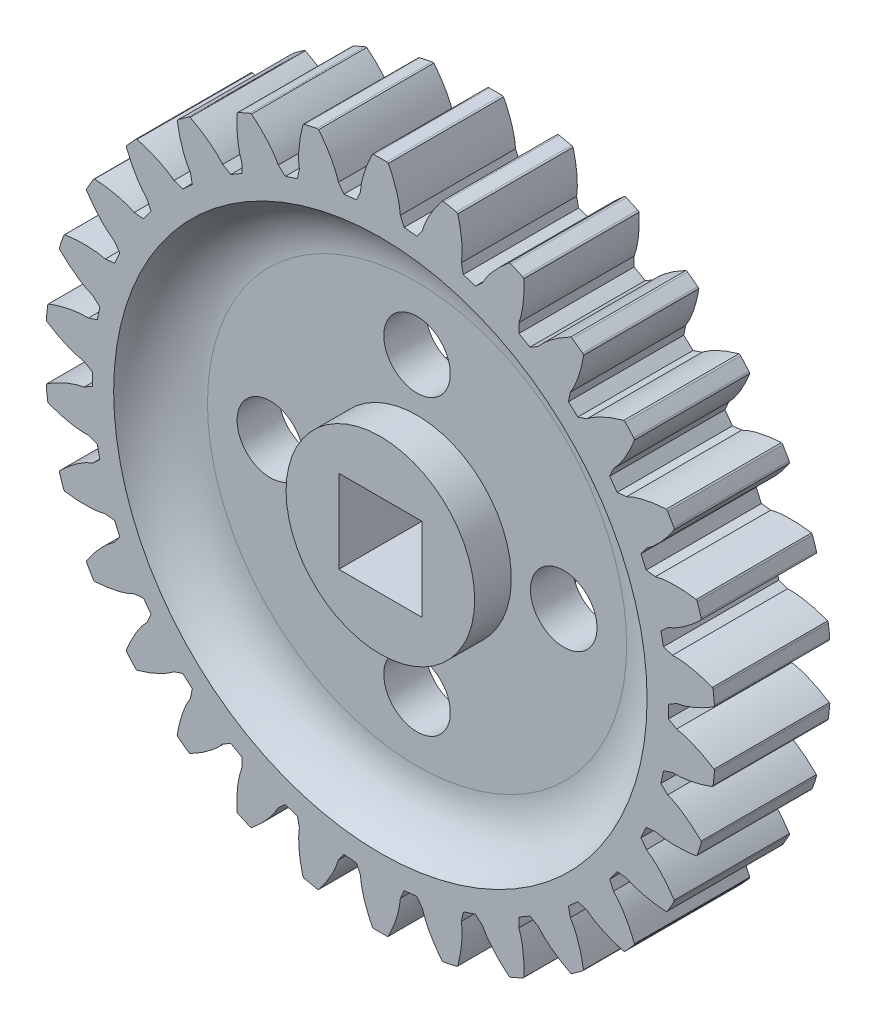
from build123d import *

# Parameters (mm, degrees)
BOSS_EXTRUDE1_DEPTH = 2.75
CIRPATTERN1_COUNT   = 4
SKETCH10_W          = 3.96875
SKETCH10_H          = 3.96875
CUT_EXTRUDE1_DEPTH  = 24.246147151


with BuildPart() as part:
    # Sketch1 → Boss-Extrude1 (new, symmetric)
    with BuildSketch(Plane.XY):
        with BuildLine():
            ThreePointArc((3.619571149, 15.585207881), (3.326587053, 15.650361612), (3.032432353, 15.710008085))
            add(Edge.make_bspline(
                [(2.94821418, 15.701878254), (2.98689529, 15.7187979), (3.032432353, 15.710008085)],
                knots=[0, 0, 0, 1, 1, 1], degree=2))
            add(Edge.make_bspline(
                [(2.002684585, 14.001333447), (2.021037482, 14.060934408), (2.039390379, 14.120535368), (2.14439226, 14.461528568), (2.613380053, 15.284185561), (2.94821418, 15.701878254)],
                knots=[-0.082147632, -0.082147632, -0.082147632, 0, 0, 0.469988803, 0.946949881, 0.946949881, 0.946949881], degree=2))
            add(Edge.make_bspline(
                [(1.737896443, 13.640815332), (1.799016307, 13.725511736), (1.860136171, 13.81020814), (1.905740786, 13.873404403), (1.953485414, 13.936409203), (1.978085, 13.968871325), (2.002684585, 14.001333447)],
                knots=[-1.340212241, -1.340212241, -1.340212241, 0, 0, 1, 1, 1.515232525, 1.515232525, 1.515232525], degree=2))
            add(Edge.make_bspline(
                [(1.136165743, 13.704059777), (1.221838194, 13.695875955), (1.307510644, 13.687692133), (1.437331013, 13.6752911), (1.566892815, 13.660429968), (1.652394629, 13.65062265), (1.737896443, 13.640815332)],
                knots=[-0.659930726, -0.659930726, -0.659930726, 0, 0, 1, 1, 1.659930726, 1.659930726, 1.659930726], degree=2))
            add(Edge.make_bspline(
                [(0.952119789, 14.111752257), (0.969432559, 14.074884968), (0.98674533, 14.03801768), (1.020347189, 13.966463019), (1.051815993, 13.895166015), (1.093990868, 13.799612896), (1.136165743, 13.704059777)],
                knots=[-0.515232525, -0.515232525, -0.515232525, 0, 0, 1, 1, 2.340212241, 2.340212241, 2.340212241], degree=2))
            add(Edge.make_bspline(
                [(0.380815431, 15.971722736), (0.721366486, 15.295101854), (0.922789827, 14.439409813), (0.940999578, 14.235980893), (0.946559683, 14.173866575), (0.952119789, 14.111752257)],
                knots=[0, 0, 0, 0.627512728, 0.879079195, 0.879079195, 0.955891673, 0.955891673, 0.955891673], degree=2))
            add(Edge.make_bspline(
                [(0.300127913, 15.997184853), (0.346497388, 15.996314902), (0.380815431, 15.971722736)],
                knots=[0, 0, 0, 1, 1, 1], degree=2))
            ThreePointArc((0.300127913, 15.997184853), (0, 16), (-0.300127913, 15.997184853))
            add(Edge.make_bspline(
                [(-0.380815431, 15.971722736), (-0.346497388, 15.996314902), (-0.300127913, 15.997184853)],
                knots=[0, 0, 0, 1, 1, 1], degree=2))
            add(Edge.make_bspline(
                [(-0.952119789, 14.111752257), (-0.946559683, 14.173866575), (-0.940999578, 14.235980893), (-0.909188712, 14.591353692), (-0.621489434, 15.493541701), (-0.380815431, 15.971722736)],
                knots=[-0.082147632, -0.082147632, -0.082147632, 0, 0, 0.469988803, 0.946949881, 0.946949881, 0.946949881], degree=2))
            add(Edge.make_bspline(
                [(-1.136165743, 13.704059777), (-1.093990868, 13.799612896), (-1.051815993, 13.895166015), (-1.020347189, 13.966463019), (-0.98674533, 14.03801768), (-0.969432559, 14.074884968), (-0.952119789, 14.111752257)],
                knots=[-1.340212241, -1.340212241, -1.340212241, 0, 0, 1, 1, 1.515232525, 1.515232525, 1.515232525], degree=2))
            add(Edge.make_bspline(
                [(-1.737896443, 13.640815332), (-1.652394629, 13.65062265), (-1.566892815, 13.660429968), (-1.437331013, 13.6752911), (-1.307510644, 13.687692133), (-1.221838194, 13.695875955), (-1.136165743, 13.704059777)],
                knots=[-0.659930726, -0.659930726, -0.659930726, 0, 0, 1, 1, 1.659930726, 1.659930726, 1.659930726], degree=2))
            add(Edge.make_bspline(
                [(-2.002684585, 14.001333447), (-1.978085, 13.968871325), (-1.953485414, 13.936409203), (-1.905740786, 13.873404403), (-1.860136171, 13.81020814), (-1.799016307, 13.725511736), (-1.737896443, 13.640815332)],
                knots=[-0.515232525, -0.515232525, -0.515232525, 0, 0, 1, 1, 2.340212241, 2.340212241, 2.340212241], degree=2))
            add(Edge.make_bspline(
                [(-2.94821418, 15.701878254), (-2.47442759, 15.110847707), (-2.099497453, 14.315732858), (-2.039390379, 14.120535368), (-2.021037482, 14.060934408), (-2.002684585, 14.001333447)],
                knots=[0, 0, 0, 0.627512728, 0.879079195, 0.879079195, 0.955891673, 0.955891673, 0.955891673], degree=2))
            add(Edge.make_bspline(
                [(-3.032432353, 15.710008085), (-2.98689529, 15.7187979), (-2.94821418, 15.701878254)],
                knots=[0, 0, 0, 1, 1, 1], degree=2))
            ThreePointArc((-3.032432353, 15.710008085), (-3.326587053, 15.650361612), (-3.619571149, 15.585207881))
            add(Edge.make_bspline(
                [(-3.693201579, 15.543526294), (-3.664746466, 15.574716184), (-3.619571149, 15.585207881)],
                knots=[0, 0, 0, 1, 1, 1], degree=2))
            add(Edge.make_bspline(
                [(-3.865311959, 13.605419777), (-3.872787648, 13.667332759), (-3.880263337, 13.729245741), (-3.923033774, 14.083466643), (-3.82919685, 15.025755723), (-3.693201579, 15.543526294)],
                knots=[-0.082147632, -0.082147632, -0.082147632, 0, 0, 0.469988803, 0.946949881, 0.946949881, 0.946949881], degree=2))
            add(Edge.make_bspline(
                [(-3.960572035, 13.168371051), (-3.939185393, 13.270604754), (-3.91779875, 13.372838458), (-3.901841096, 13.449120184), (-3.883850569, 13.526097423), (-3.874581264, 13.5657586), (-3.865311959, 13.605419777)],
                knots=[-1.340212241, -1.340212241, -1.340212241, 0, 0, 1, 1, 1.515232525, 1.515232525, 1.515232525], degree=2))
            add(Edge.make_bspline(
                [(-4.536004216, 12.981401801), (-4.454409878, 13.008771632), (-4.37281554, 13.036141463), (-4.249174777, 13.077615258), (-4.124769614, 13.11673647), (-4.042670825, 13.14255376), (-3.960572035, 13.168371051)],
                knots=[-0.659930726, -0.659930726, -0.659930726, 0, 0, 1, 1, 1.659930726, 1.659930726, 1.659930726], degree=2))
            add(Edge.make_bspline(
                [(-4.869962033, 13.27898918), (-4.839150753, 13.252350975), (-4.808339472, 13.225712769), (-4.748538744, 13.174011441), (-4.690791458, 13.121677902), (-4.613397837, 13.051539851), (-4.536004216, 12.981401801)],
                knots=[-0.515232525, -0.515232525, -0.515232525, 0, 0, 1, 1, 2.340212241, 2.340212241, 2.340212241], degree=2))
            add(Edge.make_bspline(
                [(-6.148392683, 14.745786346), (-5.562077307, 14.266177006), (-5.030026621, 13.566389682), (-4.930649189, 13.387954689), (-4.900305611, 13.333471935), (-4.869962033, 13.27898918)],
                knots=[0, 0, 0, 0.627512728, 0.879079195, 0.879079195, 0.955891673, 0.955891673, 0.955891673], degree=2))
            add(Edge.make_bspline(
                [(-6.232460774, 14.736228578), (-6.18974631, 14.754294002), (-6.148392683, 14.745786346)],
                knots=[0, 0, 0, 1, 1, 1], degree=2))
            ThreePointArc((-6.232460774, 14.736228578), (-6.507786289, 14.616727322), (-6.780821758, 14.492082538))
            add(Edge.make_bspline(
                [(-6.844177097, 14.436003166), (-6.822828539, 14.472427634), (-6.780821758, 14.492082538)],
                knots=[0, 0, 0, 1, 1, 1], degree=2))
            add(Edge.make_bspline(
                [(-6.609571449, 12.504465167), (-6.629756209, 12.563470919), (-6.649940969, 12.62247667), (-6.765423436, 12.960064522), (-6.86954999, 13.901272118), (-6.844177097, 14.436003166)],
                knots=[-0.082147632, -0.082147632, -0.082147632, 0, 0, 0.469988803, 0.946949881, 0.946949881, 0.946949881], degree=2))
            add(Edge.make_bspline(
                [(-6.611882324, 12.05716132), (-6.612218613, 12.161607505), (-6.612554902, 12.26605369), (-6.612805824, 12.34398626), (-6.611212901, 12.423021803), (-6.610392175, 12.463743485), (-6.609571449, 12.504465167)],
                knots=[-1.340212241, -1.340212241, -1.340212241, 0, 0, 1, 1, 1.515232525, 1.515232525, 1.515232525], degree=2))
            add(Edge.make_bspline(
                [(-7.135866839, 11.75463872), (-7.06174604, 11.798374871), (-6.987625242, 11.842111023), (-6.875309213, 11.908384875), (-6.761756359, 11.972516483), (-6.686819342, 12.014838902), (-6.611882324, 12.05716132)],
                knots=[-0.659930726, -0.659930726, -0.659930726, 0, 0, 1, 1, 1.659930726, 1.659930726, 1.659930726], degree=2))
            add(Edge.make_bspline(
                [(-7.524398771, 11.976289366), (-7.488722397, 11.956639295), (-7.453046023, 11.936989223), (-7.383802773, 11.898850964), (-7.316436649, 11.859667374), (-7.226151744, 11.807153047), (-7.135866839, 11.75463872)],
                knots=[-0.515232525, -0.515232525, -0.515232525, 0, 0, 1, 1, 2.340212241, 2.340212241, 2.340212241], degree=2))
            add(Edge.make_bspline(
                [(-9.079856923, 13.145232817), (-8.406637555, 12.798005913), (-7.740719488, 12.224130179), (-7.606414971, 12.070256148), (-7.565406871, 12.023272757), (-7.524398771, 11.976289366)],
                knots=[0, 0, 0, 0.627512728, 0.879079195, 0.879079195, 0.955891673, 0.955891673, 0.955891673], degree=2))
            add(Edge.make_bspline(
                [(-9.160100753, 13.11840517), (-9.122075715, 13.144956657), (-9.079856923, 13.145232817)],
                knots=[0, 0, 0, 1, 1, 1], degree=2))
            ThreePointArc((-9.160100753, 13.11840517), (-9.404564037, 12.94427191), (-9.645717917, 12.765583647))
            add(Edge.make_bspline(
                [(-9.696029233, 12.697557429), (-9.682720265, 12.737624549), (-9.645717917, 12.765583647)],
                knots=[0, 0, 0, 1, 1, 1], degree=2))
            add(Edge.make_bspline(
                [(-9.06496095, 10.857005426), (-9.096972611, 10.910525113), (-9.128984271, 10.9640448), (-9.31213163, 11.270245392), (-9.609670831, 12.169236216), (-9.696029233, 12.697557429)],
                knots=[-0.082147632, -0.082147632, -0.082147632, 0, 0, 0.469988803, 0.946949881, 0.946949881, 0.946949881], degree=2))
            add(Edge.make_bspline(
                [(-8.974221628, 10.418995784), (-8.996266151, 10.52108965), (-9.018310674, 10.623183517), (-9.034759206, 10.699360904), (-9.049633505, 10.777000518), (-9.057297228, 10.817002972), (-9.06496095, 10.857005426)],
                knots=[-1.340212241, -1.340212241, -1.340212241, 0, 0, 1, 1, 1.515232525, 1.515232525, 1.515232525], degree=2))
            add(Edge.make_bspline(
                [(-9.423857839, 10.014141521), (-9.360450015, 10.072332514), (-9.297042191, 10.130523506), (-9.200959646, 10.218700931), (-9.103221905, 10.305040075), (-9.038721767, 10.362017929), (-8.974221628, 10.418995784)],
                knots=[-0.659930726, -0.659930726, -0.659930726, 0, 0, 1, 1, 1.659930726, 1.659930726, 1.659930726], degree=2))
            add(Edge.make_bspline(
                [(-9.849983177, 10.150168239), (-9.811000937, 10.138365103), (-9.772018698, 10.126561968), (-9.69635919, 10.103653603), (-9.62231845, 10.079332473), (-9.523088144, 10.046736997), (-9.423857839, 10.014141521)],
                knots=[-0.515232525, -0.515232525, -0.515232525, 0, 0, 1, 1, 2.340212241, 2.340212241, 2.340212241], degree=2))
            add(Edge.make_bspline(
                [(-11.614487845, 10.970169536), (-10.883787403, 10.770500549), (-10.113105769, 10.347617528), (-9.949743918, 10.225029494), (-9.899863547, 10.187598866), (-9.849983177, 10.150168239)],
                knots=[0, 0, 0, 0.627512728, 0.879079195, 0.879079195, 0.955891673, 0.955891673, 0.955891673], degree=2))
            add(Edge.make_bspline(
                [(-11.687400373, 10.927244507), (-11.655726639, 10.961121631), (-11.614487845, 10.970169536)],
                knots=[0, 0, 0, 1, 1, 1], degree=2))
            ThreePointArc((-11.687400373, 10.927244507), (-11.890317208, 10.706089702), (-12.089049919, 10.481167495))
            add(Edge.make_bspline(
                [(-12.124118365, 10.404167502), (-12.119430653, 10.446126149), (-12.089049919, 10.481167495)],
                knots=[0, 0, 0, 1, 1, 1], degree=2))
            add(Edge.make_bspline(
                [(-11.12416816, 8.73504245), (-11.166607657, 8.780737005), (-11.209047154, 8.82643156), (-11.451854987, 9.087862457), (-11.929802945, 9.905346296), (-12.124118365, 10.404167502)],
                knots=[-0.082147632, -0.082147632, -0.082147632, 0, 0, 0.469988803, 0.946949881, 0.946949881, 0.946949881], degree=2))
            add(Edge.make_bspline(
                [(-10.944344384, 8.325470135), (-10.98713369, 8.420749692), (-11.029922996, 8.516029249), (-11.061850257, 8.587122135), (-11.0925417, 8.659972596), (-11.10835493, 8.697507523), (-11.12416816, 8.73504245)],
                knots=[-1.340212241, -1.340212241, -1.340212241, 0, 0, 1, 1, 1.515232525, 1.515232525, 1.515232525], degree=2))
            add(Edge.make_bspline(
                [(-11.29998103, 7.835978285), (-11.250057407, 7.906080893), (-11.200133784, 7.9761835), (-11.12448399, 8.082410721), (-11.046832971, 8.187183967), (-10.995588678, 8.256327051), (-10.944344384, 8.325470135)],
                knots=[-0.659930726, -0.659930726, -0.659930726, 0, 0, 1, 1, 1.659930726, 1.659930726, 1.659930726], degree=2))
            add(Edge.make_bspline(
                [(-11.745076052, 7.880436053), (-11.704491658, 7.876995708), (-11.663907265, 7.873555363), (-11.585138181, 7.866878096), (-11.507658762, 7.858482377), (-11.403819896, 7.847230331), (-11.29998103, 7.835978285)],
                knots=[-0.515232525, -0.515232525, -0.515232525, 0, 0, 1, 1, 2.340212241, 2.340212241, 2.340212241], degree=2))
            add(Edge.make_bspline(
                [(-13.641509916, 8.315657205), (-12.885263516, 8.27227263), (-12.0435008, 8.018864339), (-11.858221312, 7.932919986), (-11.801648682, 7.906678019), (-11.745076052, 7.880436053)],
                knots=[0, 0, 0, 0.627512728, 0.879079195, 0.879079195, 0.955891673, 0.955891673, 0.955891673], degree=2))
            add(Edge.make_bspline(
                [(-13.703904515, 8.258510824), (-13.679966378, 8.298232991), (-13.641509916, 8.315657205)],
                knots=[0, 0, 0, 1, 1, 1], degree=2))
            ThreePointArc((-13.703904515, 8.258510824), (-13.856406461, 8), (-14.004032429, 7.738674029))
            add(Edge.make_bspline(
                [(-14.022325347, 7.656065531), (-14.026463766, 7.698081911), (-14.004032429, 7.738674029)],
                knots=[0, 0, 0, 1, 1, 1], degree=2))
            add(Edge.make_bspline(
                [(-12.697195841, 6.231316204), (-12.748208365, 6.267188556), (-12.79922089, 6.303060907), (-13.091077329, 6.508296325), (-13.728545425, 7.208545213), (-14.022325347, 7.656065531)],
                knots=[-0.082147632, -0.082147632, -0.082147632, 0, 0, 0.469988803, 0.946949881, 0.946949881, 0.946949881], degree=2))
            add(Edge.make_bspline(
                [(-12.436146774, 5.868081492), (-12.497810764, 5.952382565), (-12.559474755, 6.036683638), (-12.60548537, 6.099584923), (-12.650652595, 6.164462317), (-12.673924218, 6.197889261), (-12.697195841, 6.231316204)],
                knots=[-1.340212241, -1.340212241, -1.340212241, 0, 0, 1, 1, 1.515232525, 1.515232525, 1.515232525], degree=2))
            add(Edge.make_bspline(
                [(-12.682240828, 5.315345197), (-12.647983307, 5.394295599), (-12.613725786, 5.473246001), (-12.561815003, 5.592880379), (-12.507644428, 5.711508633), (-12.471895601, 5.789795062), (-12.436146774, 5.868081492)],
                knots=[-0.659930726, -0.659930726, -0.659930726, 0, 0, 1, 1, 1.659930726, 1.659930726, 1.659930726], degree=2))
            add(Edge.make_bspline(
                [(-13.126852745, 5.266290997), (-13.08643993, 5.271363802), (-13.046027114, 5.276436607), (-12.967591043, 5.286282268), (-12.890059167, 5.294178892), (-12.786149997, 5.304762044), (-12.682240828, 5.315345197)],
                knots=[-0.515232525, -0.515232525, -0.515232525, 0, 0, 1, 1, 2.340212241, 2.340212241, 2.340212241], degree=2))
            add(Edge.make_bspline(
                [(-15.072332545, 5.297710752), (-14.323591782, 5.412506701), (-13.447537055, 5.339648299), (-13.248437533, 5.294103808), (-13.187645139, 5.280197402), (-13.126852745, 5.266290997)],
                knots=[0, 0, 0, 0.627512728, 0.879079195, 0.879079195, 0.955891673, 0.955891673, 0.955891673], degree=2))
            add(Edge.make_bspline(
                [(-15.121482272, 5.22884059), (-15.106325943, 5.27267175), (-15.072332545, 5.297710752)],
                knots=[0, 0, 0, 1, 1, 1], degree=2))
            ThreePointArc((-15.121482272, 5.22884059), (-15.216904261, 4.94427191), (-15.306971523, 4.657963374))
            add(Edge.make_bspline(
                [(-15.307689424, 4.573356758), (-15.320473106, 4.613594554), (-15.306971523, 4.657963374)],
                knots=[0, 0, 0, 1, 1, 1], degree=2))
            add(Edge.make_bspline(
                [(-13.715295136, 3.455251538), (-13.772651195, 3.479733893), (-13.830007255, 3.504216247), (-14.158156773, 3.644286413), (-14.927284592, 4.196696113), (-15.307689424, 4.573356758)],
                knots=[-0.082147632, -0.082147632, -0.082147632, 0, 0, 0.469988803, 0.946949881, 0.946949881, 0.946949881], degree=2))
            add(Edge.make_bspline(
                [(-13.384429874, 3.154229529), (-13.462273537, 3.223867757), (-13.5401172, 3.293505985), (-13.598200286, 3.345466581), (-13.655869267, 3.399535454), (-13.685582201, 3.427393496), (-13.715295136, 3.455251538)],
                knots=[-1.340212241, -1.340212241, -1.340212241, 0, 0, 1, 1, 1.515232525, 1.515232525, 1.515232525], degree=2))
            add(Edge.make_bspline(
                [(-13.510225845, 2.562406018), (-13.493131645, 2.646753703), (-13.476037445, 2.731101388), (-13.450134423, 2.858914327), (-13.421811805, 2.986212965), (-13.40312084, 3.070221247), (-13.384429874, 3.154229529)],
                knots=[-0.659930726, -0.659930726, -0.659930726, 0, 0, 1, 1, 1.659930726, 1.659930726, 1.659930726], degree=2))
            add(Edge.make_bspline(
                [(-13.934922983, 2.421983754), (-13.89644798, 2.435348003), (-13.857972977, 2.448712251), (-13.78329795, 2.474650537), (-13.709102132, 2.498494385), (-13.609663988, 2.530450201), (-13.510225845, 2.562406018)],
                knots=[-0.515232525, -0.515232525, -0.515232525, 0, 0, 1, 1, 2.340212241, 2.340212241, 2.340212241], degree=2))
            add(Edge.make_bspline(
                [(-15.844421916, 2.048228917), (-15.135910355, 2.316188258), (-14.263851413, 2.427064006), (-14.05963346, 2.423909889), (-13.997278222, 2.422946822), (-13.934922983, 2.421983754)],
                knots=[0, 0, 0, 0.627512728, 0.879079195, 0.879079195, 0.955891673, 0.955891673, 0.955891673], degree=2))
            add(Edge.make_bspline(
                [(-15.878178691, 1.97064493), (-15.872466576, 2.016669453), (-15.844421916, 2.048228917)],
                knots=[0, 0, 0, 1, 1, 1], degree=2))
            ThreePointArc((-15.878178691, 1.97064493), (-15.912350326, 1.672455412), (-15.940922511, 1.373677368))
            add(Edge.make_bspline(
                [(-15.924034019, 1.29077035), (-15.944904255, 1.327470976), (-15.940922511, 1.373677368)],
                knots=[0, 0, 0, 1, 1, 1], degree=2))
            add(Edge.make_bspline(
                [(-14.13397022, 0.528175801), (-14.19516308, 0.540198161), (-14.25635594, 0.552220522), (-14.606456829, 0.621003698), (-15.473629794, 1.001431255), (-15.924034019, 1.29077035)],
                knots=[-0.082147632, -0.082147632, -0.082147632, 0, 0, 0.469988803, 0.946949881, 0.946949881, 0.946949881], degree=2))
            add(Edge.make_bspline(
                [(-13.747749163, 0.302522601), (-13.838370357, 0.354454458), (-13.928991551, 0.406386316), (-13.996608597, 0.445135296), (-14.064258923, 0.486032579), (-14.099114572, 0.50710419), (-14.13397022, 0.528175801)],
                knots=[-1.340212241, -1.340212241, -1.340212241, 0, 0, 1, 1, 1.515232525, 1.515232525, 1.515232525], degree=2))
            add(Edge.make_bspline(
                [(-13.747749163, -0.302522601), (-13.748565382, -0.21646403), (-13.749381601, -0.13040546), (-13.750618427, 0), (-13.749381601, 0.13040546), (-13.748565382, 0.21646403), (-13.747749163, 0.302522601)],
                knots=[-0.659930726, -0.659930726, -0.659930726, 0, 0, 1, 1, 1.659930726, 1.659930726, 1.659930726], degree=2))
            add(Edge.make_bspline(
                [(-14.13397022, -0.528175801), (-14.099114572, -0.50710419), (-14.064258923, -0.486032579), (-13.996608597, -0.445135296), (-13.928991551, -0.406386316), (-13.838370357, -0.354454458), (-13.747749163, -0.302522601)],
                knots=[-0.515232525, -0.515232525, -0.515232525, 0, 0, 1, 1, 2.340212241, 2.340212241, 2.340212241], degree=2))
            add(Edge.make_bspline(
                [(-15.924034019, -1.29077035), (-15.286717016, -0.881358727), (-14.456767018, -0.591594631), (-14.25635594, -0.552220522), (-14.19516308, -0.540198161), (-14.13397022, -0.528175801)],
                knots=[0, 0, 0, 0.627512728, 0.879079195, 0.879079195, 0.955891673, 0.955891673, 0.955891673], degree=2))
            add(Edge.make_bspline(
                [(-15.940922511, -1.373677368), (-15.944904255, -1.327470976), (-15.924034019, -1.29077035)],
                knots=[0, 0, 0, 1, 1, 1], degree=2))
            ThreePointArc((-15.940922511, -1.373677368), (-15.912350326, -1.672455412), (-15.878178691, -1.97064493))
            add(Edge.make_bspline(
                [(-15.844421916, -2.048228917), (-15.872466576, -2.016669453), (-15.878178691, -1.97064493)],
                knots=[0, 0, 0, 1, 1, 1], degree=2))
            add(Edge.make_bspline(
                [(-13.934922983, -2.421983754), (-13.997278222, -2.422946822), (-14.05963346, -2.423909889), (-14.416384631, -2.429419859), (-15.343703123, -2.237600954), (-15.844421916, -2.048228917)],
                knots=[-0.082147632, -0.082147632, -0.082147632, 0, 0, 0.469988803, 0.946949881, 0.946949881, 0.946949881], degree=2))
            add(Edge.make_bspline(
                [(-13.510225845, -2.562406018), (-13.609663988, -2.530450201), (-13.709102132, -2.498494385), (-13.78329795, -2.474650537), (-13.857972977, -2.448712251), (-13.89644798, -2.435348003), (-13.934922983, -2.421983754)],
                knots=[-1.340212241, -1.340212241, -1.340212241, 0, 0, 1, 1, 1.515232525, 1.515232525, 1.515232525], degree=2))
            add(Edge.make_bspline(
                [(-13.384429874, -3.154229529), (-13.40312084, -3.070221247), (-13.421811805, -2.986212965), (-13.450134423, -2.858914327), (-13.476037445, -2.731101388), (-13.493131645, -2.646753703), (-13.510225845, -2.562406018)],
                knots=[-0.659930726, -0.659930726, -0.659930726, 0, 0, 1, 1, 1.659930726, 1.659930726, 1.659930726], degree=2))
            add(Edge.make_bspline(
                [(-13.715295136, -3.455251538), (-13.685582201, -3.427393496), (-13.655869267, -3.399535454), (-13.598200286, -3.345466581), (-13.5401172, -3.293505985), (-13.462273537, -3.223867757), (-13.384429874, -3.154229529)],
                knots=[-0.515232525, -0.515232525, -0.515232525, 0, 0, 1, 1, 2.340212241, 2.340212241, 2.340212241], degree=2))
            add(Edge.make_bspline(
                [(-15.307689424, -4.573356758), (-14.769420789, -4.040386106), (-14.017852533, -3.584397743), (-13.830007255, -3.504216247), (-13.772651195, -3.479733893), (-13.715295136, -3.455251538)],
                knots=[0, 0, 0, 0.627512728, 0.879079195, 0.879079195, 0.955891673, 0.955891673, 0.955891673], degree=2))
            add(Edge.make_bspline(
                [(-15.306971523, -4.657963374), (-15.320473106, -4.613594554), (-15.307689424, -4.573356758)],
                knots=[0, 0, 0, 1, 1, 1], degree=2))
            ThreePointArc((-15.306971523, -4.657963374), (-15.216904261, -4.94427191), (-15.121482272, -5.22884059))
            add(Edge.make_bspline(
                [(-15.072332545, -5.297710752), (-15.106325943, -5.27267175), (-15.121482272, -5.22884059)],
                knots=[0, 0, 0, 1, 1, 1], degree=2))
            add(Edge.make_bspline(
                [(-13.126852745, -5.266290997), (-13.187645139, -5.280197402), (-13.248437533, -5.294103808), (-13.596247247, -5.373666111), (-14.543182998, -5.378839264), (-15.072332545, -5.297710752)],
                knots=[-0.082147632, -0.082147632, -0.082147632, 0, 0, 0.469988803, 0.946949881, 0.946949881, 0.946949881], degree=2))
            add(Edge.make_bspline(
                [(-12.682240828, -5.315345197), (-12.786149997, -5.304762044), (-12.890059167, -5.294178892), (-12.967591043, -5.286282268), (-13.046027114, -5.276436607), (-13.08643993, -5.271363802), (-13.126852745, -5.266290997)],
                knots=[-1.340212241, -1.340212241, -1.340212241, 0, 0, 1, 1, 1.515232525, 1.515232525, 1.515232525], degree=2))
            add(Edge.make_bspline(
                [(-12.436146774, -5.868081492), (-12.471895601, -5.789795062), (-12.507644428, -5.711508633), (-12.561815003, -5.592880379), (-12.613725786, -5.473246001), (-12.647983307, -5.394295599), (-12.682240828, -5.315345197)],
                knots=[-0.659930726, -0.659930726, -0.659930726, 0, 0, 1, 1, 1.659930726, 1.659930726, 1.659930726], degree=2))
            add(Edge.make_bspline(
                [(-12.697195841, -6.231316204), (-12.673924218, -6.197889261), (-12.650652595, -6.164462317), (-12.60548537, -6.099584923), (-12.559474755, -6.036683638), (-12.497810764, -5.952382565), (-12.436146774, -5.868081492)],
                knots=[-0.515232525, -0.515232525, -0.515232525, 0, 0, 1, 1, 2.340212241, 2.340212241, 2.340212241], degree=2))
            add(Edge.make_bspline(
                [(-14.022325347, -7.656065531), (-13.606630002, -7.022829224), (-12.966290627, -6.420545474), (-12.79922089, -6.303060907), (-12.748208365, -6.267188556), (-12.697195841, -6.231316204)],
                knots=[0, 0, 0, 0.627512728, 0.879079195, 0.879079195, 0.955891673, 0.955891673, 0.955891673], degree=2))
            add(Edge.make_bspline(
                [(-14.004032429, -7.738674029), (-14.026463766, -7.698081911), (-14.022325347, -7.656065531)],
                knots=[0, 0, 0, 1, 1, 1], degree=2))
            ThreePointArc((-14.004032429, -7.738674029), (-13.856406461, -8), (-13.703904515, -8.258510824))
            add(Edge.make_bspline(
                [(-13.641509916, -8.315657205), (-13.679966378, -8.298232991), (-13.703904515, -8.258510824)],
                knots=[0, 0, 0, 1, 1, 1], degree=2))
            add(Edge.make_bspline(
                [(-11.745076052, -7.880436053), (-11.801648682, -7.906678019), (-11.858221312, -7.932919986), (-12.181888617, -8.083057367), (-13.107055991, -8.284996488), (-13.641509916, -8.315657205)],
                knots=[-0.082147632, -0.082147632, -0.082147632, 0, 0, 0.469988803, 0.946949881, 0.946949881, 0.946949881], degree=2))
            add(Edge.make_bspline(
                [(-11.29998103, -7.835978285), (-11.403819896, -7.847230331), (-11.507658762, -7.858482377), (-11.585138181, -7.866878096), (-11.663907265, -7.873555363), (-11.704491658, -7.876995708), (-11.745076052, -7.880436053)],
                knots=[-1.340212241, -1.340212241, -1.340212241, 0, 0, 1, 1, 1.515232525, 1.515232525, 1.515232525], degree=2))
            add(Edge.make_bspline(
                [(-10.944344384, -8.325470135), (-10.995588678, -8.256327051), (-11.046832971, -8.187183967), (-11.12448399, -8.082410721), (-11.200133784, -7.9761835), (-11.250057407, -7.906080893), (-11.29998103, -7.835978285)],
                knots=[-0.659930726, -0.659930726, -0.659930726, 0, 0, 1, 1, 1.659930726, 1.659930726, 1.659930726], degree=2))
            add(Edge.make_bspline(
                [(-11.12416816, -8.73504245), (-11.10835493, -8.697507523), (-11.0925417, -8.659972596), (-11.061850257, -8.587122135), (-11.029922996, -8.516029249), (-10.98713369, -8.420749692), (-10.944344384, -8.325470135)],
                knots=[-0.515232525, -0.515232525, -0.515232525, 0, 0, 1, 1, 2.340212241, 2.340212241, 2.340212241], degree=2))
            add(Edge.make_bspline(
                [(-12.124118365, -10.404167502), (-11.849164192, -9.698341006), (-11.348039602, -8.976084559), (-11.209047154, -8.82643156), (-11.166607657, -8.780737005), (-11.12416816, -8.73504245)],
                knots=[0, 0, 0, 0.627512728, 0.879079195, 0.879079195, 0.955891673, 0.955891673, 0.955891673], degree=2))
            add(Edge.make_bspline(
                [(-12.089049919, -10.481167495), (-12.119430653, -10.446126149), (-12.124118365, -10.404167502)],
                knots=[0, 0, 0, 1, 1, 1], degree=2))
            ThreePointArc((-12.089049919, -10.481167495), (-11.890317208, -10.706089702), (-11.687400373, -10.927244507))
            add(Edge.make_bspline(
                [(-11.614487845, -10.970169536), (-11.655726639, -10.961121631), (-11.687400373, -10.927244507)],
                knots=[0, 0, 0, 1, 1, 1], degree=2))
            add(Edge.make_bspline(
                [(-9.849983177, -10.150168239), (-9.899863547, -10.187598866), (-9.949743918, -10.225029494), (-10.235122999, -10.43918023), (-11.098087742, -10.82905961), (-11.614487845, -10.970169536)],
                knots=[-0.082147632, -0.082147632, -0.082147632, 0, 0, 0.469988803, 0.946949881, 0.946949881, 0.946949881], degree=2))
            add(Edge.make_bspline(
                [(-9.423857839, -10.014141521), (-9.523088144, -10.046736997), (-9.62231845, -10.079332473), (-9.69635919, -10.103653603), (-9.772018698, -10.126561968), (-9.811000937, -10.138365103), (-9.849983177, -10.150168239)],
                knots=[-1.340212241, -1.340212241, -1.340212241, 0, 0, 1, 1, 1.515232525, 1.515232525, 1.515232525], degree=2))
            add(Edge.make_bspline(
                [(-8.974221628, -10.418995784), (-9.038721767, -10.362017929), (-9.103221905, -10.305040075), (-9.200959646, -10.218700931), (-9.297042191, -10.130523506), (-9.360450015, -10.072332514), (-9.423857839, -10.014141521)],
                knots=[-0.659930726, -0.659930726, -0.659930726, 0, 0, 1, 1, 1.659930726, 1.659930726, 1.659930726], degree=2))
            add(Edge.make_bspline(
                [(-9.06496095, -10.857005426), (-9.057297228, -10.817002972), (-9.049633505, -10.777000518), (-9.034759206, -10.699360904), (-9.018310674, -10.623183517), (-8.996266151, -10.52108965), (-8.974221628, -10.418995784)],
                knots=[-0.515232525, -0.515232525, -0.515232525, 0, 0, 1, 1, 2.340212241, 2.340212241, 2.340212241], degree=2))
            add(Edge.make_bspline(
                [(-9.696029233, -12.697557429), (-9.573833049, -11.949988748), (-9.233824792, -11.139325676), (-9.128984271, -10.9640448), (-9.096972611, -10.910525113), (-9.06496095, -10.857005426)],
                knots=[0, 0, 0, 0.627512728, 0.879079195, 0.879079195, 0.955891673, 0.955891673, 0.955891673], degree=2))
            add(Edge.make_bspline(
                [(-9.645717917, -12.765583647), (-9.682720265, -12.737624549), (-9.696029233, -12.697557429)],
                knots=[0, 0, 0, 1, 1, 1], degree=2))
            ThreePointArc((-9.645717917, -12.765583647), (-9.404564037, -12.94427191), (-9.160100753, -13.11840517))
            add(Edge.make_bspline(
                [(-9.079856923, -13.145232817), (-9.122075715, -13.144956657), (-9.160100753, -13.11840517)],
                knots=[0, 0, 0, 1, 1, 1], degree=2))
            add(Edge.make_bspline(
                [(-7.524398771, -11.976289366), (-7.565406871, -12.023272757), (-7.606414971, -12.070256148), (-7.841033392, -12.339060824), (-8.604079804, -12.899840863), (-9.079856923, -13.145232817)],
                knots=[-0.082147632, -0.082147632, -0.082147632, 0, 0, 0.469988803, 0.946949881, 0.946949881, 0.946949881], degree=2))
            add(Edge.make_bspline(
                [(-7.135866839, -11.75463872), (-7.226151744, -11.807153047), (-7.316436649, -11.859667374), (-7.383802773, -11.898850964), (-7.453046023, -11.936989223), (-7.488722397, -11.956639295), (-7.524398771, -11.976289366)],
                knots=[-1.340212241, -1.340212241, -1.340212241, 0, 0, 1, 1, 1.515232525, 1.515232525, 1.515232525], degree=2))
            add(Edge.make_bspline(
                [(-6.611882324, -12.05716132), (-6.686819342, -12.014838902), (-6.761756359, -11.972516483), (-6.875309213, -11.908384875), (-6.987625242, -11.842111023), (-7.06174604, -11.798374871), (-7.135866839, -11.75463872)],
                knots=[-0.659930726, -0.659930726, -0.659930726, 0, 0, 1, 1, 1.659930726, 1.659930726, 1.659930726], degree=2))
            add(Edge.make_bspline(
                [(-6.609571449, -12.504465167), (-6.610392175, -12.463743485), (-6.611212901, -12.423021803), (-6.612805824, -12.34398626), (-6.612554902, -12.26605369), (-6.612218613, -12.161607505), (-6.611882324, -12.05716132)],
                knots=[-0.515232525, -0.515232525, -0.515232525, 0, 0, 1, 1, 2.340212241, 2.340212241, 2.340212241], degree=2))
            add(Edge.make_bspline(
                [(-6.844177097, -14.436003166), (-6.88007946, -13.67936464), (-6.71604753, -12.815724809), (-6.649940969, -12.62247667), (-6.629756209, -12.563470919), (-6.609571449, -12.504465167)],
                knots=[0, 0, 0, 0.627512728, 0.879079195, 0.879079195, 0.955891673, 0.955891673, 0.955891673], degree=2))
            add(Edge.make_bspline(
                [(-6.780821758, -14.492082538), (-6.822828539, -14.472427634), (-6.844177097, -14.436003166)],
                knots=[0, 0, 0, 1, 1, 1], degree=2))
            ThreePointArc((-6.780821758, -14.492082538), (-6.507786289, -14.616727322), (-6.232460774, -14.736228578))
            add(Edge.make_bspline(
                [(-6.148392683, -14.745786346), (-6.18974631, -14.754294002), (-6.232460774, -14.736228578)],
                knots=[0, 0, 0, 1, 1, 1], degree=2))
            add(Edge.make_bspline(
                [(-4.869962033, -13.27898918), (-4.900305611, -13.333471935), (-4.930649189, -13.387954689), (-5.104253001, -13.699665251), (-5.734032292, -14.40683717), (-6.148392683, -14.745786346)],
                knots=[-0.082147632, -0.082147632, -0.082147632, 0, 0, 0.469988803, 0.946949881, 0.946949881, 0.946949881], degree=2))
            add(Edge.make_bspline(
                [(-4.536004216, -12.981401801), (-4.613397837, -13.051539851), (-4.690791458, -13.121677902), (-4.748538744, -13.174011441), (-4.808339472, -13.225712769), (-4.839150753, -13.252350975), (-4.869962033, -13.27898918)],
                knots=[-1.340212241, -1.340212241, -1.340212241, 0, 0, 1, 1, 1.515232525, 1.515232525, 1.515232525], degree=2))
            add(Edge.make_bspline(
                [(-3.960572035, -13.168371051), (-4.042670825, -13.14255376), (-4.124769614, -13.11673647), (-4.249174777, -13.077615258), (-4.37281554, -13.036141463), (-4.454409878, -13.008771632), (-4.536004216, -12.981401801)],
                knots=[-0.659930726, -0.659930726, -0.659930726, 0, 0, 1, 1, 1.659930726, 1.659930726, 1.659930726], degree=2))
            add(Edge.make_bspline(
                [(-3.865311959, -13.605419777), (-3.874581264, -13.5657586), (-3.883850569, -13.526097423), (-3.901841096, -13.449120184), (-3.91779875, -13.372838458), (-3.939185393, -13.270604754), (-3.960572035, -13.168371051)],
                knots=[-0.515232525, -0.515232525, -0.515232525, 0, 0, 1, 1, 2.340212241, 2.340212241, 2.340212241], degree=2))
            add(Edge.make_bspline(
                [(-3.693201579, -15.543526294), (-3.885633386, -14.810886655), (-3.904746764, -13.932015271), (-3.880263337, -13.729245741), (-3.872787648, -13.667332759), (-3.865311959, -13.605419777)],
                knots=[0, 0, 0, 0.627512728, 0.879079195, 0.879079195, 0.955891673, 0.955891673, 0.955891673], degree=2))
            add(Edge.make_bspline(
                [(-3.619571149, -15.585207881), (-3.664746466, -15.574716184), (-3.693201579, -15.543526294)],
                knots=[0, 0, 0, 1, 1, 1], degree=2))
            ThreePointArc((-3.619571149, -15.585207881), (-3.326587053, -15.650361612), (-3.032432353, -15.710008085))
            add(Edge.make_bspline(
                [(-2.94821418, -15.701878254), (-2.98689529, -15.7187979), (-3.032432353, -15.710008085)],
                knots=[0, 0, 0, 1, 1, 1], degree=2))
            add(Edge.make_bspline(
                [(-2.002684585, -14.001333447), (-2.021037482, -14.060934408), (-2.039390379, -14.120535368), (-2.14439226, -14.461528568), (-2.613380053, -15.284185561), (-2.94821418, -15.701878254)],
                knots=[-0.082147632, -0.082147632, -0.082147632, 0, 0, 0.469988803, 0.946949881, 0.946949881, 0.946949881], degree=2))
            add(Edge.make_bspline(
                [(-1.737896443, -13.640815332), (-1.799016307, -13.725511736), (-1.860136171, -13.81020814), (-1.905740786, -13.873404403), (-1.953485414, -13.936409203), (-1.978085, -13.968871325), (-2.002684585, -14.001333447)],
                knots=[-1.340212241, -1.340212241, -1.340212241, 0, 0, 1, 1, 1.515232525, 1.515232525, 1.515232525], degree=2))
            add(Edge.make_bspline(
                [(-1.136165743, -13.704059777), (-1.221838194, -13.695875955), (-1.307510644, -13.687692133), (-1.437331013, -13.6752911), (-1.566892815, -13.660429968), (-1.652394629, -13.65062265), (-1.737896443, -13.640815332)],
                knots=[-0.659930726, -0.659930726, -0.659930726, 0, 0, 1, 1, 1.659930726, 1.659930726, 1.659930726], degree=2))
            add(Edge.make_bspline(
                [(-0.952119789, -14.111752257), (-0.969432559, -14.074884968), (-0.98674533, -14.03801768), (-1.020347189, -13.966463019), (-1.051815993, -13.895166015), (-1.093990868, -13.799612896), (-1.136165743, -13.704059777)],
                knots=[-0.515232525, -0.515232525, -0.515232525, 0, 0, 1, 1, 2.340212241, 2.340212241, 2.340212241], degree=2))
            add(Edge.make_bspline(
                [(-0.380815431, -15.971722736), (-0.721366486, -15.295101854), (-0.922789827, -14.439409813), (-0.940999578, -14.235980893), (-0.946559683, -14.173866575), (-0.952119789, -14.111752257)],
                knots=[0, 0, 0, 0.627512728, 0.879079195, 0.879079195, 0.955891673, 0.955891673, 0.955891673], degree=2))
            add(Edge.make_bspline(
                [(-0.300127913, -15.997184853), (-0.346497388, -15.996314902), (-0.380815431, -15.971722736)],
                knots=[0, 0, 0, 1, 1, 1], degree=2))
            ThreePointArc((-0.300127913, -15.997184853), (0, -16), (0.300127913, -15.997184853))
            add(Edge.make_bspline(
                [(0.380815431, -15.971722736), (0.346497388, -15.996314902), (0.300127913, -15.997184853)],
                knots=[0, 0, 0, 1, 1, 1], degree=2))
            add(Edge.make_bspline(
                [(0.952119789, -14.111752257), (0.946559683, -14.173866575), (0.940999578, -14.235980893), (0.909188712, -14.591353692), (0.621489434, -15.493541701), (0.380815431, -15.971722736)],
                knots=[-0.082147632, -0.082147632, -0.082147632, 0, 0, 0.469988803, 0.946949881, 0.946949881, 0.946949881], degree=2))
            add(Edge.make_bspline(
                [(1.136165743, -13.704059777), (1.093990868, -13.799612896), (1.051815993, -13.895166015), (1.020347189, -13.966463019), (0.98674533, -14.03801768), (0.969432559, -14.074884968), (0.952119789, -14.111752257)],
                knots=[-1.340212241, -1.340212241, -1.340212241, 0, 0, 1, 1, 1.515232525, 1.515232525, 1.515232525], degree=2))
            add(Edge.make_bspline(
                [(1.737896443, -13.640815332), (1.652394629, -13.65062265), (1.566892815, -13.660429968), (1.437331013, -13.6752911), (1.307510644, -13.687692133), (1.221838194, -13.695875955), (1.136165743, -13.704059777)],
                knots=[-0.659930726, -0.659930726, -0.659930726, 0, 0, 1, 1, 1.659930726, 1.659930726, 1.659930726], degree=2))
            add(Edge.make_bspline(
                [(2.002684585, -14.001333447), (1.978085, -13.968871325), (1.953485414, -13.936409203), (1.905740786, -13.873404403), (1.860136171, -13.81020814), (1.799016307, -13.725511736), (1.737896443, -13.640815332)],
                knots=[-0.515232525, -0.515232525, -0.515232525, 0, 0, 1, 1, 2.340212241, 2.340212241, 2.340212241], degree=2))
            add(Edge.make_bspline(
                [(2.94821418, -15.701878254), (2.47442759, -15.110847707), (2.099497453, -14.315732858), (2.039390379, -14.120535368), (2.021037482, -14.060934408), (2.002684585, -14.001333447)],
                knots=[0, 0, 0, 0.627512728, 0.879079195, 0.879079195, 0.955891673, 0.955891673, 0.955891673], degree=2))
            add(Edge.make_bspline(
                [(3.032432353, -15.710008085), (2.98689529, -15.7187979), (2.94821418, -15.701878254)],
                knots=[0, 0, 0, 1, 1, 1], degree=2))
            ThreePointArc((3.032432353, -15.710008085), (3.326587053, -15.650361612), (3.619571149, -15.585207881))
            add(Edge.make_bspline(
                [(3.693201579, -15.543526294), (3.664746466, -15.574716184), (3.619571149, -15.585207881)],
                knots=[0, 0, 0, 1, 1, 1], degree=2))
            add(Edge.make_bspline(
                [(3.865311959, -13.605419777), (3.872787648, -13.667332759), (3.880263337, -13.729245741), (3.923033774, -14.083466643), (3.82919685, -15.025755723), (3.693201579, -15.543526294)],
                knots=[-0.082147632, -0.082147632, -0.082147632, 0, 0, 0.469988803, 0.946949881, 0.946949881, 0.946949881], degree=2))
            add(Edge.make_bspline(
                [(3.960572035, -13.168371051), (3.939185393, -13.270604754), (3.91779875, -13.372838458), (3.901841096, -13.449120184), (3.883850569, -13.526097423), (3.874581264, -13.5657586), (3.865311959, -13.605419777)],
                knots=[-1.340212241, -1.340212241, -1.340212241, 0, 0, 1, 1, 1.515232525, 1.515232525, 1.515232525], degree=2))
            add(Edge.make_bspline(
                [(4.536004216, -12.981401801), (4.454409878, -13.008771632), (4.37281554, -13.036141463), (4.249174777, -13.077615258), (4.124769614, -13.11673647), (4.042670825, -13.14255376), (3.960572035, -13.168371051)],
                knots=[-0.659930726, -0.659930726, -0.659930726, 0, 0, 1, 1, 1.659930726, 1.659930726, 1.659930726], degree=2))
            add(Edge.make_bspline(
                [(4.869962033, -13.27898918), (4.839150753, -13.252350975), (4.808339472, -13.225712769), (4.748538744, -13.174011441), (4.690791458, -13.121677902), (4.613397837, -13.051539851), (4.536004216, -12.981401801)],
                knots=[-0.515232525, -0.515232525, -0.515232525, 0, 0, 1, 1, 2.340212241, 2.340212241, 2.340212241], degree=2))
            add(Edge.make_bspline(
                [(6.148392683, -14.745786346), (5.562077307, -14.266177006), (5.030026621, -13.566389682), (4.930649189, -13.387954689), (4.900305611, -13.333471935), (4.869962033, -13.27898918)],
                knots=[0, 0, 0, 0.627512728, 0.879079195, 0.879079195, 0.955891673, 0.955891673, 0.955891673], degree=2))
            add(Edge.make_bspline(
                [(6.232460774, -14.736228578), (6.18974631, -14.754294002), (6.148392683, -14.745786346)],
                knots=[0, 0, 0, 1, 1, 1], degree=2))
            ThreePointArc((6.232460774, -14.736228578), (6.507786289, -14.616727322), (6.780821758, -14.492082538))
            add(Edge.make_bspline(
                [(6.844177097, -14.436003166), (6.822828539, -14.472427634), (6.780821758, -14.492082538)],
                knots=[0, 0, 0, 1, 1, 1], degree=2))
            add(Edge.make_bspline(
                [(6.609571449, -12.504465167), (6.629756209, -12.563470919), (6.649940969, -12.62247667), (6.765423436, -12.960064522), (6.86954999, -13.901272118), (6.844177097, -14.436003166)],
                knots=[-0.082147632, -0.082147632, -0.082147632, 0, 0, 0.469988803, 0.946949881, 0.946949881, 0.946949881], degree=2))
            add(Edge.make_bspline(
                [(6.611882324, -12.05716132), (6.612218613, -12.161607505), (6.612554902, -12.26605369), (6.612805824, -12.34398626), (6.611212901, -12.423021803), (6.610392175, -12.463743485), (6.609571449, -12.504465167)],
                knots=[-1.340212241, -1.340212241, -1.340212241, 0, 0, 1, 1, 1.515232525, 1.515232525, 1.515232525], degree=2))
            add(Edge.make_bspline(
                [(7.135866839, -11.75463872), (7.06174604, -11.798374871), (6.987625242, -11.842111023), (6.875309213, -11.908384875), (6.761756359, -11.972516483), (6.686819342, -12.014838902), (6.611882324, -12.05716132)],
                knots=[-0.659930726, -0.659930726, -0.659930726, 0, 0, 1, 1, 1.659930726, 1.659930726, 1.659930726], degree=2))
            add(Edge.make_bspline(
                [(7.524398771, -11.976289366), (7.488722397, -11.956639295), (7.453046023, -11.936989223), (7.383802773, -11.898850964), (7.316436649, -11.859667374), (7.226151744, -11.807153047), (7.135866839, -11.75463872)],
                knots=[-0.515232525, -0.515232525, -0.515232525, 0, 0, 1, 1, 2.340212241, 2.340212241, 2.340212241], degree=2))
            add(Edge.make_bspline(
                [(9.079856923, -13.145232817), (8.406637555, -12.798005913), (7.740719488, -12.224130179), (7.606414971, -12.070256148), (7.565406871, -12.023272757), (7.524398771, -11.976289366)],
                knots=[0, 0, 0, 0.627512728, 0.879079195, 0.879079195, 0.955891673, 0.955891673, 0.955891673], degree=2))
            add(Edge.make_bspline(
                [(9.160100753, -13.11840517), (9.122075715, -13.144956657), (9.079856923, -13.145232817)],
                knots=[0, 0, 0, 1, 1, 1], degree=2))
            ThreePointArc((9.160100753, -13.11840517), (9.404564037, -12.94427191), (9.645717917, -12.765583647))
            add(Edge.make_bspline(
                [(9.696029233, -12.697557429), (9.682720265, -12.737624549), (9.645717917, -12.765583647)],
                knots=[0, 0, 0, 1, 1, 1], degree=2))
            add(Edge.make_bspline(
                [(9.06496095, -10.857005426), (9.096972611, -10.910525113), (9.128984271, -10.9640448), (9.31213163, -11.270245392), (9.609670831, -12.169236216), (9.696029233, -12.697557429)],
                knots=[-0.082147632, -0.082147632, -0.082147632, 0, 0, 0.469988803, 0.946949881, 0.946949881, 0.946949881], degree=2))
            add(Edge.make_bspline(
                [(8.974221628, -10.418995784), (8.996266151, -10.52108965), (9.018310674, -10.623183517), (9.034759206, -10.699360904), (9.049633505, -10.777000518), (9.057297228, -10.817002972), (9.06496095, -10.857005426)],
                knots=[-1.340212241, -1.340212241, -1.340212241, 0, 0, 1, 1, 1.515232525, 1.515232525, 1.515232525], degree=2))
            add(Edge.make_bspline(
                [(9.423857839, -10.014141521), (9.360450015, -10.072332514), (9.297042191, -10.130523506), (9.200959646, -10.218700931), (9.103221905, -10.305040075), (9.038721767, -10.362017929), (8.974221628, -10.418995784)],
                knots=[-0.659930726, -0.659930726, -0.659930726, 0, 0, 1, 1, 1.659930726, 1.659930726, 1.659930726], degree=2))
            add(Edge.make_bspline(
                [(9.849983177, -10.150168239), (9.811000937, -10.138365103), (9.772018698, -10.126561968), (9.69635919, -10.103653603), (9.62231845, -10.079332473), (9.523088144, -10.046736997), (9.423857839, -10.014141521)],
                knots=[-0.515232525, -0.515232525, -0.515232525, 0, 0, 1, 1, 2.340212241, 2.340212241, 2.340212241], degree=2))
            add(Edge.make_bspline(
                [(11.614487845, -10.970169536), (10.883787403, -10.770500549), (10.113105769, -10.347617528), (9.949743918, -10.225029494), (9.899863547, -10.187598866), (9.849983177, -10.150168239)],
                knots=[0, 0, 0, 0.627512728, 0.879079195, 0.879079195, 0.955891673, 0.955891673, 0.955891673], degree=2))
            add(Edge.make_bspline(
                [(11.687400373, -10.927244507), (11.655726639, -10.961121631), (11.614487845, -10.970169536)],
                knots=[0, 0, 0, 1, 1, 1], degree=2))
            ThreePointArc((11.687400373, -10.927244507), (11.890317208, -10.706089702), (12.089049919, -10.481167495))
            add(Edge.make_bspline(
                [(12.124118365, -10.404167502), (12.119430653, -10.446126149), (12.089049919, -10.481167495)],
                knots=[0, 0, 0, 1, 1, 1], degree=2))
            add(Edge.make_bspline(
                [(11.12416816, -8.73504245), (11.166607657, -8.780737005), (11.209047154, -8.82643156), (11.451854987, -9.087862457), (11.929802945, -9.905346296), (12.124118365, -10.404167502)],
                knots=[-0.082147632, -0.082147632, -0.082147632, 0, 0, 0.469988803, 0.946949881, 0.946949881, 0.946949881], degree=2))
            add(Edge.make_bspline(
                [(10.944344384, -8.325470135), (10.98713369, -8.420749692), (11.029922996, -8.516029249), (11.061850257, -8.587122135), (11.0925417, -8.659972596), (11.10835493, -8.697507523), (11.12416816, -8.73504245)],
                knots=[-1.340212241, -1.340212241, -1.340212241, 0, 0, 1, 1, 1.515232525, 1.515232525, 1.515232525], degree=2))
            add(Edge.make_bspline(
                [(11.29998103, -7.835978285), (11.250057407, -7.906080893), (11.200133784, -7.9761835), (11.12448399, -8.082410721), (11.046832971, -8.187183967), (10.995588678, -8.256327051), (10.944344384, -8.325470135)],
                knots=[-0.659930726, -0.659930726, -0.659930726, 0, 0, 1, 1, 1.659930726, 1.659930726, 1.659930726], degree=2))
            add(Edge.make_bspline(
                [(11.745076052, -7.880436053), (11.704491658, -7.876995708), (11.663907265, -7.873555363), (11.585138181, -7.866878096), (11.507658762, -7.858482377), (11.403819896, -7.847230331), (11.29998103, -7.835978285)],
                knots=[-0.515232525, -0.515232525, -0.515232525, 0, 0, 1, 1, 2.340212241, 2.340212241, 2.340212241], degree=2))
            add(Edge.make_bspline(
                [(13.641509916, -8.315657205), (12.885263516, -8.27227263), (12.0435008, -8.018864339), (11.858221312, -7.932919986), (11.801648682, -7.906678019), (11.745076052, -7.880436053)],
                knots=[0, 0, 0, 0.627512728, 0.879079195, 0.879079195, 0.955891673, 0.955891673, 0.955891673], degree=2))
            add(Edge.make_bspline(
                [(13.703904515, -8.258510824), (13.679966378, -8.298232991), (13.641509916, -8.315657205)],
                knots=[0, 0, 0, 1, 1, 1], degree=2))
            ThreePointArc((13.703904515, -8.258510824), (13.856406461, -8), (14.004032429, -7.738674029))
            add(Edge.make_bspline(
                [(14.022325347, -7.656065531), (14.026463766, -7.698081911), (14.004032429, -7.738674029)],
                knots=[0, 0, 0, 1, 1, 1], degree=2))
            add(Edge.make_bspline(
                [(12.697195841, -6.231316204), (12.748208365, -6.267188556), (12.79922089, -6.303060907), (13.091077329, -6.508296325), (13.728545425, -7.208545213), (14.022325347, -7.656065531)],
                knots=[-0.082147632, -0.082147632, -0.082147632, 0, 0, 0.469988803, 0.946949881, 0.946949881, 0.946949881], degree=2))
            add(Edge.make_bspline(
                [(12.436146774, -5.868081492), (12.497810764, -5.952382565), (12.559474755, -6.036683638), (12.60548537, -6.099584923), (12.650652595, -6.164462317), (12.673924218, -6.197889261), (12.697195841, -6.231316204)],
                knots=[-1.340212241, -1.340212241, -1.340212241, 0, 0, 1, 1, 1.515232525, 1.515232525, 1.515232525], degree=2))
            add(Edge.make_bspline(
                [(12.682240828, -5.315345197), (12.647983307, -5.394295599), (12.613725786, -5.473246001), (12.561815003, -5.592880379), (12.507644428, -5.711508633), (12.471895601, -5.789795062), (12.436146774, -5.868081492)],
                knots=[-0.659930726, -0.659930726, -0.659930726, 0, 0, 1, 1, 1.659930726, 1.659930726, 1.659930726], degree=2))
            add(Edge.make_bspline(
                [(13.126852745, -5.266290997), (13.08643993, -5.271363802), (13.046027114, -5.276436607), (12.967591043, -5.286282268), (12.890059167, -5.294178892), (12.786149997, -5.304762044), (12.682240828, -5.315345197)],
                knots=[-0.515232525, -0.515232525, -0.515232525, 0, 0, 1, 1, 2.340212241, 2.340212241, 2.340212241], degree=2))
            add(Edge.make_bspline(
                [(15.072332545, -5.297710752), (14.323591782, -5.412506701), (13.447537055, -5.339648299), (13.248437533, -5.294103808), (13.187645139, -5.280197402), (13.126852745, -5.266290997)],
                knots=[0, 0, 0, 0.627512728, 0.879079195, 0.879079195, 0.955891673, 0.955891673, 0.955891673], degree=2))
            add(Edge.make_bspline(
                [(15.121482272, -5.22884059), (15.106325943, -5.27267175), (15.072332545, -5.297710752)],
                knots=[0, 0, 0, 1, 1, 1], degree=2))
            ThreePointArc((15.121482272, -5.22884059), (15.216904261, -4.94427191), (15.306971523, -4.657963374))
            add(Edge.make_bspline(
                [(15.307689424, -4.573356758), (15.320473106, -4.613594554), (15.306971523, -4.657963374)],
                knots=[0, 0, 0, 1, 1, 1], degree=2))
            add(Edge.make_bspline(
                [(13.715295136, -3.455251538), (13.772651195, -3.479733893), (13.830007255, -3.504216247), (14.158156773, -3.644286413), (14.927284592, -4.196696113), (15.307689424, -4.573356758)],
                knots=[-0.082147632, -0.082147632, -0.082147632, 0, 0, 0.469988803, 0.946949881, 0.946949881, 0.946949881], degree=2))
            add(Edge.make_bspline(
                [(13.384429874, -3.154229529), (13.462273537, -3.223867757), (13.5401172, -3.293505985), (13.598200286, -3.345466581), (13.655869267, -3.399535454), (13.685582201, -3.427393496), (13.715295136, -3.455251538)],
                knots=[-1.340212241, -1.340212241, -1.340212241, 0, 0, 1, 1, 1.515232525, 1.515232525, 1.515232525], degree=2))
            add(Edge.make_bspline(
                [(13.510225845, -2.562406018), (13.493131645, -2.646753703), (13.476037445, -2.731101388), (13.450134423, -2.858914327), (13.421811805, -2.986212965), (13.40312084, -3.070221247), (13.384429874, -3.154229529)],
                knots=[-0.659930726, -0.659930726, -0.659930726, 0, 0, 1, 1, 1.659930726, 1.659930726, 1.659930726], degree=2))
            add(Edge.make_bspline(
                [(13.934922983, -2.421983754), (13.89644798, -2.435348003), (13.857972977, -2.448712251), (13.78329795, -2.474650537), (13.709102132, -2.498494385), (13.609663988, -2.530450201), (13.510225845, -2.562406018)],
                knots=[-0.515232525, -0.515232525, -0.515232525, 0, 0, 1, 1, 2.340212241, 2.340212241, 2.340212241], degree=2))
            add(Edge.make_bspline(
                [(15.844421916, -2.048228917), (15.135910355, -2.316188258), (14.263851413, -2.427064006), (14.05963346, -2.423909889), (13.997278222, -2.422946822), (13.934922983, -2.421983754)],
                knots=[0, 0, 0, 0.627512728, 0.879079195, 0.879079195, 0.955891673, 0.955891673, 0.955891673], degree=2))
            add(Edge.make_bspline(
                [(15.878178691, -1.97064493), (15.872466576, -2.016669453), (15.844421916, -2.048228917)],
                knots=[0, 0, 0, 1, 1, 1], degree=2))
            ThreePointArc((15.878178691, -1.97064493), (15.912350326, -1.672455412), (15.940922511, -1.373677368))
            add(Edge.make_bspline(
                [(15.924034019, -1.29077035), (15.944904255, -1.327470976), (15.940922511, -1.373677368)],
                knots=[0, 0, 0, 1, 1, 1], degree=2))
            add(Edge.make_bspline(
                [(14.13397022, -0.528175801), (14.19516308, -0.540198161), (14.25635594, -0.552220522), (14.606456829, -0.621003698), (15.473629794, -1.001431255), (15.924034019, -1.29077035)],
                knots=[-0.082147632, -0.082147632, -0.082147632, 0, 0, 0.469988803, 0.946949881, 0.946949881, 0.946949881], degree=2))
            add(Edge.make_bspline(
                [(13.747749163, -0.302522601), (13.838370357, -0.354454458), (13.928991551, -0.406386316), (13.996608597, -0.445135296), (14.064258923, -0.486032579), (14.099114572, -0.50710419), (14.13397022, -0.528175801)],
                knots=[-1.340212241, -1.340212241, -1.340212241, 0, 0, 1, 1, 1.515232525, 1.515232525, 1.515232525], degree=2))
            add(Edge.make_bspline(
                [(13.747749163, 0.302522601), (13.748565382, 0.21646403), (13.749381601, 0.13040546), (13.750618427, 0), (13.749381601, -0.13040546), (13.748565382, -0.21646403), (13.747749163, -0.302522601)],
                knots=[-0.659930726, -0.659930726, -0.659930726, 0, 0, 1, 1, 1.659930726, 1.659930726, 1.659930726], degree=2))
            add(Edge.make_bspline(
                [(14.13397022, 0.528175801), (14.099114572, 0.50710419), (14.064258923, 0.486032579), (13.996608597, 0.445135296), (13.928991551, 0.406386316), (13.838370357, 0.354454458), (13.747749163, 0.302522601)],
                knots=[-0.515232525, -0.515232525, -0.515232525, 0, 0, 1, 1, 2.340212241, 2.340212241, 2.340212241], degree=2))
            add(Edge.make_bspline(
                [(15.924034019, 1.29077035), (15.286717016, 0.881358727), (14.456767018, 0.591594631), (14.25635594, 0.552220522), (14.19516308, 0.540198161), (14.13397022, 0.528175801)],
                knots=[0, 0, 0, 0.627512728, 0.879079195, 0.879079195, 0.955891673, 0.955891673, 0.955891673], degree=2))
            add(Edge.make_bspline(
                [(15.940922511, 1.373677368), (15.944904255, 1.327470976), (15.924034019, 1.29077035)],
                knots=[0, 0, 0, 1, 1, 1], degree=2))
            ThreePointArc((15.940922511, 1.373677368), (15.912350326, 1.672455412), (15.878178691, 1.97064493))
            add(Edge.make_bspline(
                [(15.844421916, 2.048228917), (15.872466576, 2.016669453), (15.878178691, 1.97064493)],
                knots=[0, 0, 0, 1, 1, 1], degree=2))
            add(Edge.make_bspline(
                [(13.934922983, 2.421983754), (13.997278222, 2.422946822), (14.05963346, 2.423909889), (14.416384631, 2.429419859), (15.343703123, 2.237600954), (15.844421916, 2.048228917)],
                knots=[-0.082147632, -0.082147632, -0.082147632, 0, 0, 0.469988803, 0.946949881, 0.946949881, 0.946949881], degree=2))
            add(Edge.make_bspline(
                [(13.510225845, 2.562406018), (13.609663988, 2.530450201), (13.709102132, 2.498494385), (13.78329795, 2.474650537), (13.857972977, 2.448712251), (13.89644798, 2.435348003), (13.934922983, 2.421983754)],
                knots=[-1.340212241, -1.340212241, -1.340212241, 0, 0, 1, 1, 1.515232525, 1.515232525, 1.515232525], degree=2))
            add(Edge.make_bspline(
                [(13.384429874, 3.154229529), (13.40312084, 3.070221247), (13.421811805, 2.986212965), (13.450134423, 2.858914327), (13.476037445, 2.731101388), (13.493131645, 2.646753703), (13.510225845, 2.562406018)],
                knots=[-0.659930726, -0.659930726, -0.659930726, 0, 0, 1, 1, 1.659930726, 1.659930726, 1.659930726], degree=2))
            add(Edge.make_bspline(
                [(13.715295136, 3.455251538), (13.685582201, 3.427393496), (13.655869267, 3.399535454), (13.598200286, 3.345466581), (13.5401172, 3.293505985), (13.462273537, 3.223867757), (13.384429874, 3.154229529)],
                knots=[-0.515232525, -0.515232525, -0.515232525, 0, 0, 1, 1, 2.340212241, 2.340212241, 2.340212241], degree=2))
            add(Edge.make_bspline(
                [(15.307689424, 4.573356758), (14.769420789, 4.040386106), (14.017852533, 3.584397743), (13.830007255, 3.504216247), (13.772651195, 3.479733893), (13.715295136, 3.455251538)],
                knots=[0, 0, 0, 0.627512728, 0.879079195, 0.879079195, 0.955891673, 0.955891673, 0.955891673], degree=2))
            add(Edge.make_bspline(
                [(15.306971523, 4.657963374), (15.320473106, 4.613594554), (15.307689424, 4.573356758)],
                knots=[0, 0, 0, 1, 1, 1], degree=2))
            ThreePointArc((15.306971523, 4.657963374), (15.216904261, 4.94427191), (15.121482272, 5.22884059))
            add(Edge.make_bspline(
                [(15.072332545, 5.297710752), (15.106325943, 5.27267175), (15.121482272, 5.22884059)],
                knots=[0, 0, 0, 1, 1, 1], degree=2))
            add(Edge.make_bspline(
                [(13.126852745, 5.266290997), (13.187645139, 5.280197402), (13.248437533, 5.294103808), (13.596247247, 5.373666111), (14.543182998, 5.378839264), (15.072332545, 5.297710752)],
                knots=[-0.082147632, -0.082147632, -0.082147632, 0, 0, 0.469988803, 0.946949881, 0.946949881, 0.946949881], degree=2))
            add(Edge.make_bspline(
                [(12.682240828, 5.315345197), (12.786149997, 5.304762044), (12.890059167, 5.294178892), (12.967591043, 5.286282268), (13.046027114, 5.276436607), (13.08643993, 5.271363802), (13.126852745, 5.266290997)],
                knots=[-1.340212241, -1.340212241, -1.340212241, 0, 0, 1, 1, 1.515232525, 1.515232525, 1.515232525], degree=2))
            add(Edge.make_bspline(
                [(12.436146774, 5.868081492), (12.471895601, 5.789795062), (12.507644428, 5.711508633), (12.561815003, 5.592880379), (12.613725786, 5.473246001), (12.647983307, 5.394295599), (12.682240828, 5.315345197)],
                knots=[-0.659930726, -0.659930726, -0.659930726, 0, 0, 1, 1, 1.659930726, 1.659930726, 1.659930726], degree=2))
            add(Edge.make_bspline(
                [(12.697195841, 6.231316204), (12.673924218, 6.197889261), (12.650652595, 6.164462317), (12.60548537, 6.099584923), (12.559474755, 6.036683638), (12.497810764, 5.952382565), (12.436146774, 5.868081492)],
                knots=[-0.515232525, -0.515232525, -0.515232525, 0, 0, 1, 1, 2.340212241, 2.340212241, 2.340212241], degree=2))
            add(Edge.make_bspline(
                [(14.022325347, 7.656065531), (13.606630002, 7.022829224), (12.966290627, 6.420545474), (12.79922089, 6.303060907), (12.748208365, 6.267188556), (12.697195841, 6.231316204)],
                knots=[0, 0, 0, 0.627512728, 0.879079195, 0.879079195, 0.955891673, 0.955891673, 0.955891673], degree=2))
            add(Edge.make_bspline(
                [(14.004032429, 7.738674029), (14.026463766, 7.698081911), (14.022325347, 7.656065531)],
                knots=[0, 0, 0, 1, 1, 1], degree=2))
            ThreePointArc((14.004032429, 7.738674029), (13.856406461, 8), (13.703904515, 8.258510824))
            add(Edge.make_bspline(
                [(13.641509916, 8.315657205), (13.679966378, 8.298232991), (13.703904515, 8.258510824)],
                knots=[0, 0, 0, 1, 1, 1], degree=2))
            add(Edge.make_bspline(
                [(11.745076052, 7.880436053), (11.801648682, 7.906678019), (11.858221312, 7.932919986), (12.181888617, 8.083057367), (13.107055991, 8.284996488), (13.641509916, 8.315657205)],
                knots=[-0.082147632, -0.082147632, -0.082147632, 0, 0, 0.469988803, 0.946949881, 0.946949881, 0.946949881], degree=2))
            add(Edge.make_bspline(
                [(11.29998103, 7.835978285), (11.403819896, 7.847230331), (11.507658762, 7.858482377), (11.585138181, 7.866878096), (11.663907265, 7.873555363), (11.704491658, 7.876995708), (11.745076052, 7.880436053)],
                knots=[-1.340212241, -1.340212241, -1.340212241, 0, 0, 1, 1, 1.515232525, 1.515232525, 1.515232525], degree=2))
            add(Edge.make_bspline(
                [(10.944344384, 8.325470135), (10.995588678, 8.256327051), (11.046832971, 8.187183967), (11.12448399, 8.082410721), (11.200133784, 7.9761835), (11.250057407, 7.906080893), (11.29998103, 7.835978285)],
                knots=[-0.659930726, -0.659930726, -0.659930726, 0, 0, 1, 1, 1.659930726, 1.659930726, 1.659930726], degree=2))
            add(Edge.make_bspline(
                [(11.12416816, 8.73504245), (11.10835493, 8.697507523), (11.0925417, 8.659972596), (11.061850257, 8.587122135), (11.029922996, 8.516029249), (10.98713369, 8.420749692), (10.944344384, 8.325470135)],
                knots=[-0.515232525, -0.515232525, -0.515232525, 0, 0, 1, 1, 2.340212241, 2.340212241, 2.340212241], degree=2))
            add(Edge.make_bspline(
                [(12.124118365, 10.404167502), (11.849164192, 9.698341006), (11.348039602, 8.976084559), (11.209047154, 8.82643156), (11.166607657, 8.780737005), (11.12416816, 8.73504245)],
                knots=[0, 0, 0, 0.627512728, 0.879079195, 0.879079195, 0.955891673, 0.955891673, 0.955891673], degree=2))
            add(Edge.make_bspline(
                [(12.089049919, 10.481167495), (12.119430653, 10.446126149), (12.124118365, 10.404167502)],
                knots=[0, 0, 0, 1, 1, 1], degree=2))
            ThreePointArc((12.089049919, 10.481167495), (11.890317208, 10.706089702), (11.687400373, 10.927244507))
            add(Edge.make_bspline(
                [(11.614487845, 10.970169536), (11.655726639, 10.961121631), (11.687400373, 10.927244507)],
                knots=[0, 0, 0, 1, 1, 1], degree=2))
            add(Edge.make_bspline(
                [(9.849983177, 10.150168239), (9.899863547, 10.187598866), (9.949743918, 10.225029494), (10.235122999, 10.43918023), (11.098087742, 10.82905961), (11.614487845, 10.970169536)],
                knots=[-0.082147632, -0.082147632, -0.082147632, 0, 0, 0.469988803, 0.946949881, 0.946949881, 0.946949881], degree=2))
            add(Edge.make_bspline(
                [(9.423857839, 10.014141521), (9.523088144, 10.046736997), (9.62231845, 10.079332473), (9.69635919, 10.103653603), (9.772018698, 10.126561968), (9.811000937, 10.138365103), (9.849983177, 10.150168239)],
                knots=[-1.340212241, -1.340212241, -1.340212241, 0, 0, 1, 1, 1.515232525, 1.515232525, 1.515232525], degree=2))
            add(Edge.make_bspline(
                [(8.974221628, 10.418995784), (9.038721767, 10.362017929), (9.103221905, 10.305040075), (9.200959646, 10.218700931), (9.297042191, 10.130523506), (9.360450015, 10.072332514), (9.423857839, 10.014141521)],
                knots=[-0.659930726, -0.659930726, -0.659930726, 0, 0, 1, 1, 1.659930726, 1.659930726, 1.659930726], degree=2))
            add(Edge.make_bspline(
                [(9.06496095, 10.857005426), (9.057297228, 10.817002972), (9.049633505, 10.777000518), (9.034759206, 10.699360904), (9.018310674, 10.623183517), (8.996266151, 10.52108965), (8.974221628, 10.418995784)],
                knots=[-0.515232525, -0.515232525, -0.515232525, 0, 0, 1, 1, 2.340212241, 2.340212241, 2.340212241], degree=2))
            add(Edge.make_bspline(
                [(9.696029233, 12.697557429), (9.573833049, 11.949988748), (9.233824792, 11.139325676), (9.128984271, 10.9640448), (9.096972611, 10.910525113), (9.06496095, 10.857005426)],
                knots=[0, 0, 0, 0.627512728, 0.879079195, 0.879079195, 0.955891673, 0.955891673, 0.955891673], degree=2))
            add(Edge.make_bspline(
                [(9.645717917, 12.765583647), (9.682720265, 12.737624549), (9.696029233, 12.697557429)],
                knots=[0, 0, 0, 1, 1, 1], degree=2))
            ThreePointArc((9.645717917, 12.765583647), (9.404564037, 12.94427191), (9.160100753, 13.11840517))
            add(Edge.make_bspline(
                [(9.079856923, 13.145232817), (9.122075715, 13.144956657), (9.160100753, 13.11840517)],
                knots=[0, 0, 0, 1, 1, 1], degree=2))
            add(Edge.make_bspline(
                [(7.524398771, 11.976289366), (7.565406871, 12.023272757), (7.606414971, 12.070256148), (7.841033392, 12.339060824), (8.604079804, 12.899840863), (9.079856923, 13.145232817)],
                knots=[-0.082147632, -0.082147632, -0.082147632, 0, 0, 0.469988803, 0.946949881, 0.946949881, 0.946949881], degree=2))
            add(Edge.make_bspline(
                [(7.135866839, 11.75463872), (7.226151744, 11.807153047), (7.316436649, 11.859667374), (7.383802773, 11.898850964), (7.453046023, 11.936989223), (7.488722397, 11.956639295), (7.524398771, 11.976289366)],
                knots=[-1.340212241, -1.340212241, -1.340212241, 0, 0, 1, 1, 1.515232525, 1.515232525, 1.515232525], degree=2))
            add(Edge.make_bspline(
                [(6.611882324, 12.05716132), (6.686819342, 12.014838902), (6.761756359, 11.972516483), (6.875309213, 11.908384875), (6.987625242, 11.842111023), (7.06174604, 11.798374871), (7.135866839, 11.75463872)],
                knots=[-0.659930726, -0.659930726, -0.659930726, 0, 0, 1, 1, 1.659930726, 1.659930726, 1.659930726], degree=2))
            add(Edge.make_bspline(
                [(6.609571449, 12.504465167), (6.610392175, 12.463743485), (6.611212901, 12.423021803), (6.612805824, 12.34398626), (6.612554902, 12.26605369), (6.612218613, 12.161607505), (6.611882324, 12.05716132)],
                knots=[-0.515232525, -0.515232525, -0.515232525, 0, 0, 1, 1, 2.340212241, 2.340212241, 2.340212241], degree=2))
            add(Edge.make_bspline(
                [(6.844177097, 14.436003166), (6.88007946, 13.67936464), (6.71604753, 12.815724809), (6.649940969, 12.62247667), (6.629756209, 12.563470919), (6.609571449, 12.504465167)],
                knots=[0, 0, 0, 0.627512728, 0.879079195, 0.879079195, 0.955891673, 0.955891673, 0.955891673], degree=2))
            add(Edge.make_bspline(
                [(6.780821758, 14.492082538), (6.822828539, 14.472427634), (6.844177097, 14.436003166)],
                knots=[0, 0, 0, 1, 1, 1], degree=2))
            ThreePointArc((6.780821758, 14.492082538), (6.507786289, 14.616727322), (6.232460774, 14.736228578))
            add(Edge.make_bspline(
                [(6.148392683, 14.745786346), (6.18974631, 14.754294002), (6.232460774, 14.736228578)],
                knots=[0, 0, 0, 1, 1, 1], degree=2))
            add(Edge.make_bspline(
                [(4.869962033, 13.27898918), (4.900305611, 13.333471935), (4.930649189, 13.387954689), (5.104253001, 13.699665251), (5.734032292, 14.40683717), (6.148392683, 14.745786346)],
                knots=[-0.082147632, -0.082147632, -0.082147632, 0, 0, 0.469988803, 0.946949881, 0.946949881, 0.946949881], degree=2))
            add(Edge.make_bspline(
                [(4.536004216, 12.981401801), (4.613397837, 13.051539851), (4.690791458, 13.121677902), (4.748538744, 13.174011441), (4.808339472, 13.225712769), (4.839150753, 13.252350975), (4.869962033, 13.27898918)],
                knots=[-1.340212241, -1.340212241, -1.340212241, 0, 0, 1, 1, 1.515232525, 1.515232525, 1.515232525], degree=2))
            add(Edge.make_bspline(
                [(3.960572035, 13.168371051), (4.042670825, 13.14255376), (4.124769614, 13.11673647), (4.249174777, 13.077615258), (4.37281554, 13.036141463), (4.454409878, 13.008771632), (4.536004216, 12.981401801)],
                knots=[-0.659930726, -0.659930726, -0.659930726, 0, 0, 1, 1, 1.659930726, 1.659930726, 1.659930726], degree=2))
            add(Edge.make_bspline(
                [(3.865311959, 13.605419777), (3.874581264, 13.5657586), (3.883850569, 13.526097423), (3.901841096, 13.449120184), (3.91779875, 13.372838458), (3.939185393, 13.270604754), (3.960572035, 13.168371051)],
                knots=[-0.515232525, -0.515232525, -0.515232525, 0, 0, 1, 1, 2.340212241, 2.340212241, 2.340212241], degree=2))
            add(Edge.make_bspline(
                [(3.693201579, 15.543526294), (3.885633386, 14.810886655), (3.904746764, 13.932015271), (3.880263337, 13.729245741), (3.872787648, 13.667332759), (3.865311959, 13.605419777)],
                knots=[0, 0, 0, 0.627512728, 0.879079195, 0.879079195, 0.955891673, 0.955891673, 0.955891673], degree=2))
            add(Edge.make_bspline(
                [(3.619571149, 15.585207881), (3.664746466, 15.574716184), (3.693201579, 15.543526294)],
                knots=[0, 0, 0, 1, 1, 1], degree=2))
        make_face()
    extrude(amount=BOSS_EXTRUDE1_DEPTH, both=True)

    # Sketch5 → Cut-Revolve1 (revolve, cut)
    with BuildSketch(Plane(origin=(0, 0, 0), x_dir=(0, 0, -1), z_dir=(1, 0, 0))):
        with BuildLine():
            Line((1, 4.5), (3, 4.5))
            Line((3, 4.5), (3, 12.828427125))
            ThreePointArc((3, 12.828427125), (1.550510257, 11.732050808), (1, 10))
            Line((1, 10), (1, 4.5))
        make_face()
    cut_revolve1 = revolve(axis=Axis((0, 0, -3.2875), (0, 0, 1)), mode=Mode.SUBTRACT)

    # Mirror1: Cut-Revolve1 across plane
    add(cut_revolve1.mirror(Plane.XY), mode=Mode.SUBTRACT)

    # Sketch8 → 1/8 (0.125) Diameter Hole2 (revolve, cut)
    with BuildSketch(Plane(origin=(0, 7, -1), x_dir=(0, 1, 0), z_dir=(1, 0, 0))):
        Polygon((0, 0), (0, 10.963866233), (1.5875, 10.01), (1.5875, 0), align=None)
    f_1_8_0_125_diameter_hole2 = revolve(axis=Axis((0, 7, -7.35), (0, 0, 1)), mode=Mode.SUBTRACT)

    # CirPattern1: 1/8 (0.125) Diameter Hole2 ×4 about axis
    cirpattern1_axis = Axis((0, 0, -3.2875), (0, 0, 1))
    for i in range(1, CIRPATTERN1_COUNT):
        add(f_1_8_0_125_diameter_hole2.rotate(cirpattern1_axis, i * 360 / CIRPATTERN1_COUNT), mode=Mode.SUBTRACT)

    # Sketch10 → Cut-Extrude1 (cut, through all)
    with BuildSketch(Plane.XY.offset(2.75)):
        Rectangle(SKETCH10_W, SKETCH10_H)
    extrude(amount=-CUT_EXTRUDE1_DEPTH, mode=Mode.SUBTRACT)


solid = part.part
